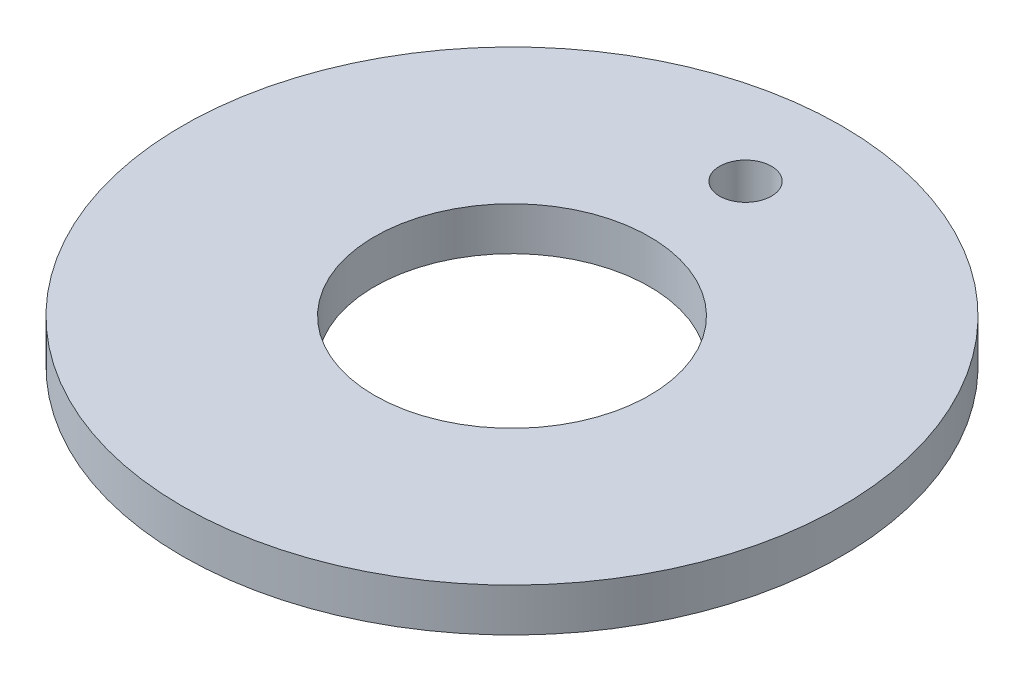
from build123d import *

# Parameters (mm, degrees)
SKETCH1_R           = 38.1
SKETCH1_R_2         = 15.9
SKETCH1_R_3         = 3
BOSS_EXTRUDE1_DEPTH = 5


with BuildPart() as part:
    # Sketch1 → Boss-Extrude1 (new body)
    with BuildSketch(Plane(origin=(0, 0, 0), x_dir=(1, 0, 0), z_dir=(0, 1, 0))):
        Circle(SKETCH1_R)
        Circle(SKETCH1_R_2, mode=Mode.SUBTRACT)
        with Locations((0, 27)):
            Circle(SKETCH1_R_3, mode=Mode.SUBTRACT)
    extrude(amount=BOSS_EXTRUDE1_DEPTH)


solid = part.part
